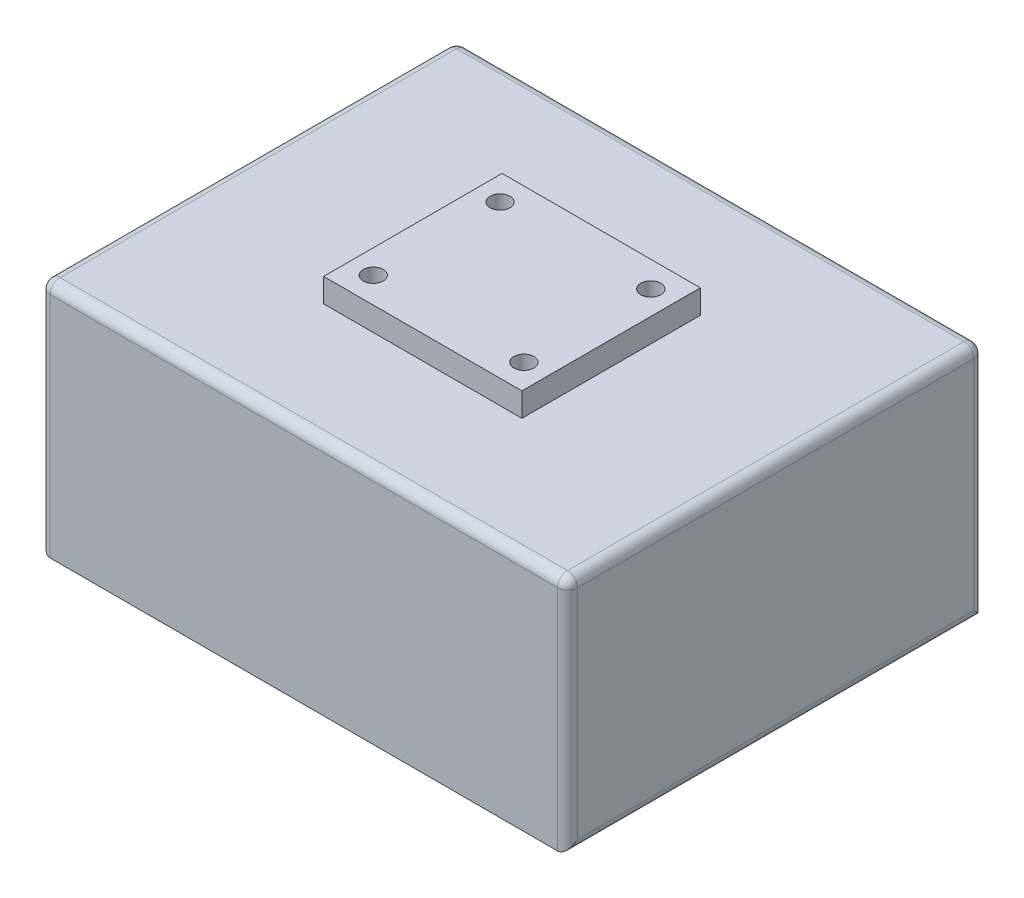
from build123d import *

# Parameters (mm, degrees)
SKETCH1_W           = 133
SKETCH1_H           = 105
BOSS_EXTRUDE1_DEPTH = 60
CUT_EXTRUDE1_START  = -2
CUT_EXTRUDE1_DEPTH  = 129
SKETCH3_R           = 42.5
CUT_EXTRUDE2_DEPTH  = 10
FILLET1_R           = 2.5
SKETCH4_W           = 50
SKETCH4_H           = 45
BOSS_EXTRUDE2_DEPTH = 6
SKETCH5_R           = 2.525
CUT_EXTRUDE3_DEPTH  = 4
BOSS_EXTRUDE3_START = 6.5
BOSS_EXTRUDE3_DEPTH = 5
BOSS_EXTRUDE4_START = 11.5
BOSS_EXTRUDE4_DEPTH = 5
CUT_EXTRUDE5_REACH  = 182.394


with BuildPart() as part:
    # Sketch1 → Boss-Extrude1 (new body)
    with BuildSketch(Plane(origin=(0, 0, 0), x_dir=(1, 0, 0), z_dir=(0, 1, 0))):
        with Locations((66.5, 52.5)):
            Rectangle(SKETCH1_W, SKETCH1_H)
    extrude(amount=BOSS_EXTRUDE1_DEPTH)

    # Sketch2 → Cut-Extrude1 (cut)
    with BuildSketch(Plane.ZY.offset(CUT_EXTRUDE1_START)):
        with BuildLine():
            Line((-99, 0), (-6, 0))
            ThreePointArc((-6, 0), (-52.5, 46.5), (-99, 0))
        make_face()
    extrude(amount=-CUT_EXTRUDE1_DEPTH, mode=Mode.SUBTRACT)

    # Sketch3 → Cut-Extrude2 (cut)
    with BuildSketch(Plane.ZY):
        with Locations((-52.5, 0)):
            Circle(SKETCH3_R)
    extrude(amount=-CUT_EXTRUDE2_DEPTH, mode=Mode.SUBTRACT)

    # Fillet1
    # the kernel refuses this fillet: 2.5 mm, written as the material it takes off along each edge
    with BuildSketch(Plane(origin=(130.5, 57.5, -102.5), x_dir=(0, 1, 0), z_dir=(1, 0, 0))) as fillet1_piece_1_section:
        Polygon((0, 0), (FILLET1_R * 1.02, 0), (FILLET1_R * 1.02, -FILLET1_R * 1.02), (0, -FILLET1_R * 1.02), align=None)
    fillet1_piece_1 = extrude(amount=FILLET1_R * 1.02, mode=Mode.PRIVATE)
    fillet1_piece_1 = fillet1_piece_1 - Plane(origin=(130.5, 57.5, -102.5), x_dir=(0, -0.7071067811865475, 0.7071067811865475), z_dir=(1, 0, 0)) * Sphere(FILLET1_R, mode=Mode.PRIVATE)
    add(fillet1_piece_1, mode=Mode.SUBTRACT)
    with BuildSketch(Plane(origin=(2.5, 57.5, -102.5), x_dir=(0, 1, 0), z_dir=(-1, 0, 0))) as fillet1_piece_2_section:
        Polygon((0, 0), (FILLET1_R * 1.02, 0), (FILLET1_R * 1.02, FILLET1_R * 1.02), (0, FILLET1_R * 1.02), align=None)
    fillet1_piece_2 = extrude(amount=FILLET1_R * 1.02, mode=Mode.PRIVATE)
    fillet1_piece_2 = fillet1_piece_2 - Plane(origin=(2.5, 57.5, -102.5), x_dir=(0, -0.7071067811865475, 0.7071067811865475), z_dir=(-1, 0, 0)) * Sphere(FILLET1_R, mode=Mode.PRIVATE)
    add(fillet1_piece_2, mode=Mode.SUBTRACT)
    with BuildSketch(Plane(origin=(130.5, 57.5, -2.5), x_dir=(1, 0, 0), z_dir=(0, 0, 1))) as fillet1_piece_3_section:
        Polygon((0, 0), (FILLET1_R * 1.02, 0), (FILLET1_R * 1.02, FILLET1_R * 1.02), (0, FILLET1_R * 1.02), align=None)
    fillet1_piece_3 = extrude(amount=FILLET1_R * 1.02, mode=Mode.PRIVATE)
    fillet1_piece_3 = fillet1_piece_3 - Plane(origin=(130.5, 57.5, -2.5), x_dir=(-0.7071067811865475, -0.7071067811865475, 0), z_dir=(0, 0, 1)) * Sphere(FILLET1_R, mode=Mode.PRIVATE)
    add(fillet1_piece_3, mode=Mode.SUBTRACT)
    with BuildSketch(Plane(origin=(2.5, 57.5, -2.5), x_dir=(-1, 0, 0), z_dir=(0, 0, 1))) as fillet1_piece_4_section:
        Polygon((0, 0), (FILLET1_R * 1.02, 0), (FILLET1_R * 1.02, -FILLET1_R * 1.02), (0, -FILLET1_R * 1.02), align=None)
    fillet1_piece_4 = extrude(amount=FILLET1_R * 1.02, mode=Mode.PRIVATE)
    fillet1_piece_4 = fillet1_piece_4 - Plane(origin=(2.5, 57.5, -2.5), x_dir=(0.7071067811865475, -0.7071067811865475, 0), z_dir=(0, 0, 1)) * Sphere(FILLET1_R, mode=Mode.PRIVATE)
    add(fillet1_piece_4, mode=Mode.SUBTRACT)
    with BuildSketch(Plane(origin=(130.5, 60, -105), x_dir=(0, 0, 1), z_dir=(-1, 0, 0))) as fillet1_piece_5:
        with BuildLine():
            CenterArc((FILLET1_R, -FILLET1_R), FILLET1_R, 90, 90)
            Line((0, -FILLET1_R), (0, 0))
            Line((0, 0), (FILLET1_R, 0))
        make_face()
    extrude(amount=128, mode=Mode.SUBTRACT)
    with BuildSketch(Plane(origin=(133, 60, -2.5), x_dir=(0, -1, 0), z_dir=(0, 0, -1)), Plane(origin=(0, 60, -102.5), x_dir=(0, -1, 0), z_dir=(0, 0, 1))) as fillet1_piece_6:
        with BuildLine():
            CenterArc((FILLET1_R, FILLET1_R), FILLET1_R, 180, 90)
            Line((0, FILLET1_R), (0, 0))
            Line((0, 0), (FILLET1_R, 0))
        make_face()
    extrude(amount=100, mode=Mode.SUBTRACT)
    with BuildSketch(Plane(origin=(2.5, 60, 0), x_dir=(0, -1, 0), z_dir=(1, 0, 0))) as fillet1_piece_7:
        with BuildLine():
            CenterArc((FILLET1_R, FILLET1_R), FILLET1_R, 180, 90)
            Line((0, FILLET1_R), (0, 0))
            Line((0, 0), (FILLET1_R, 0))
        make_face()
    extrude(amount=128, mode=Mode.SUBTRACT)
    with BuildSketch(Plane(origin=(133, -6.25, 0), x_dir=(-1, 0, 0), z_dir=(0, 1, 0)), Plane(origin=(133, -6.25, -105), x_dir=(0, 0, 1), z_dir=(0, 1, 0))) as fillet1_piece_8:
        with BuildLine():
            CenterArc((FILLET1_R, -FILLET1_R), FILLET1_R, 90, 90)
            Line((0, -FILLET1_R), (0, 0))
            Line((0, 0), (FILLET1_R, 0))
        make_face()
    extrude(amount=63.75, mode=Mode.SUBTRACT)
    with BuildSketch(Plane(origin=(133, 0, 6.25), x_dir=(0, 1, 0), z_dir=(0, 0, -1))) as fillet1_piece_9:
        with BuildLine():
            CenterArc((FILLET1_R, -FILLET1_R), FILLET1_R, 90, 90)
            Line((0, -FILLET1_R), (0, 0))
            Line((0, 0), (FILLET1_R, 0))
        make_face()
    extrude(amount=117.5, mode=Mode.SUBTRACT)
    with BuildSketch(Plane(origin=(0, -6.25, -105), x_dir=(0, 0, 1), z_dir=(0, 1, 0)), Plane(origin=(0, -6.25, 0), x_dir=(1, 0, 0), z_dir=(0, 1, 0))) as fillet1_piece_10:
        with BuildLine():
            CenterArc((FILLET1_R, FILLET1_R), FILLET1_R, 180, 90)
            Line((0, FILLET1_R), (0, 0))
            Line((0, 0), (FILLET1_R, 0))
        make_face()
    extrude(amount=63.75, mode=Mode.SUBTRACT)
    with BuildSketch(Plane(origin=(0, 0, -16.25), x_dir=(0, 1, 0), z_dir=(0, 0, 1)), Plane(origin=(0, 0, -111.25), x_dir=(0, 1, 0), z_dir=(0, 0, 1))) as fillet1_piece_11:
        with BuildLine():
            CenterArc((FILLET1_R, -FILLET1_R), FILLET1_R, 90, 90)
            Line((0, -FILLET1_R), (0, 0))
            Line((0, 0), (FILLET1_R, 0))
        make_face()
    extrude(amount=22.5, mode=Mode.SUBTRACT)
    with BuildSketch(Plane(origin=(0, 0, -52.5), x_dir=(0, -0.14381889116089097, 0.9896040251258337), z_dir=(0, -0.9896040251258337, -0.14381889116089097))) as fillet1_piece_12:
        with BuildLine():
            CenterArc((44.949489743, -2.5), FILLET1_R, 90, 78.463040967)
            Line((42.5, -2), (42.5, 0))
            Line((42.5, 0), (44.949489743, 0))
        make_face()
    revolve(axis=Axis((0, 0, -52.5), (-1, 0, 0)), revolution_arc=196.537779553, mode=Mode.SUBTRACT)

    # Sketch4 → Boss-Extrude2 (add)
    with BuildSketch(Plane(origin=(0, 60, 0), x_dir=(1, 0, 0), z_dir=(0, 1, 0))):
        with Locations((66.5, 52.5)):
            Rectangle(SKETCH4_W, SKETCH4_H)
    extrude(amount=BOSS_EXTRUDE2_DEPTH)

    # Sketch5 → Cut-Extrude3 (cut)
    with BuildSketch(Plane(origin=(0, 66, 0), x_dir=(1, 0, 0), z_dir=(0, 1, 0))):
        with Locations(Location((47.5, 68.5, 0), (0, 0, 270))):
            Circle(SKETCH5_R)
        with Locations(Location((85.5, 68.5, 0), (0, 0, 270))):
            Circle(SKETCH5_R)
        with Locations(Location((85.5, 36.5, 0), (0, 0, 270))):
            Circle(SKETCH5_R)
        with Locations(Location((47.5, 36.5, 0), (0, 0, 270))):
            Circle(SKETCH5_R)
    extrude(amount=-CUT_EXTRUDE3_DEPTH, mode=Mode.SUBTRACT)

    # Sketch6 → Boss-Extrude3 (add)
    with BuildSketch(Plane(origin=(2, 0, 0), x_dir=(0, 0, -1), z_dir=(1, 0, 0)).offset(BOSS_EXTRUDE3_START)):
        with BuildLine():
            Line((94.999969985, 0.050510257), (98.999972567, 0.050510257))
            ThreePointArc((98.999972567, 0.050510257), (52.5, 46.5), (6.000027433, 0.050510257))
            Line((6.000027433, 0.050510257), (10.000030015, 0.050510257))
            ThreePointArc((10.000030015, 0.050510257), (52.5, 42.5), (94.999969985, 0.050510257))
        make_face()
    extrude(amount=BOSS_EXTRUDE3_DEPTH)

    # Sketch7 → Boss-Extrude4 (add)
    with BuildSketch(Plane.ZY.offset(-131).offset(BOSS_EXTRUDE4_START)):
        with BuildLine():
            Line((-6.000027433, 0.050510257), (-10.000030015, 0.050510257))
            ThreePointArc((-10.000030015, 0.050510257), (-52.5, 42.5), (-94.999969985, 0.050510257))
            Line((-94.999969985, 0.050510257), (-98.999972567, 0.050510257))
            ThreePointArc((-98.999972567, 0.050510257), (-52.5, 46.5), (-6.000027433, 0.050510257))
        make_face()
    extrude(amount=-BOSS_EXTRUDE4_DEPTH)

    # Cut-Extrude5: up to this face of the body (flat: up to its plane)
    cut_extrude5_end = Plane(part.part.faces().sort_by_distance((131, 19.762510478, -52.5))[0])
    # Sketch14 → Cut-Extrude5 (cut, up to the picked face)
    with BuildSketch(Plane.ZY.offset(-2), mode=Mode.PRIVATE) as cut_extrude5_sk1:
        with BuildLine():
            Line((-22.531752229, 44.110383395), (-18.996218323, 47.645917301))
            Line((-18.996218323, 47.645917301), (-4.854082699, 33.503781677))
            Line((-4.854082699, 33.503781677), (-8.389616605, 29.968247771))
            ThreePointArc((-8.389616605, 29.968247771), (-10.100706376, 23.286397782), (-9.016282965, 16.474718596))
            Line((-9.016282965, 16.474718596), (-12.593550728, 14.619346994))
            ThreePointArc((-12.593550728, 14.619346994), (-22.4479618, 30.0520382), (-37.880653006, 39.906449272))
            Line((-37.880653006, 39.906449272), (-36.025281404, 43.483717035))
            ThreePointArc((-36.025281404, 43.483717035), (-29.213602218, 42.399293624), (-22.531752229, 44.110383395))
        make_face()
    cut_extrude5_tool1 = split(extrude(cut_extrude5_sk1.sketch, amount=-CUT_EXTRUDE5_REACH, mode=Mode.PRIVATE), bisect_by=cut_extrude5_end, keep=Keep.BOTH, mode=Mode.PRIVATE)
    cut_extrude5 = cut_extrude5_tool1.solids().sort_by(Axis((2, 34.053009, -18.446991), (1, 0, 0)))[0]
    add(cut_extrude5, mode=Mode.SUBTRACT)

    # Mirror3: Cut-Extrude5 across plane
    add(cut_extrude5.mirror(Plane(origin=(0, 0, -52.5), x_dir=(1, 0, 0), z_dir=(0, 0, -1))), mode=Mode.SUBTRACT)


solid = part.part
